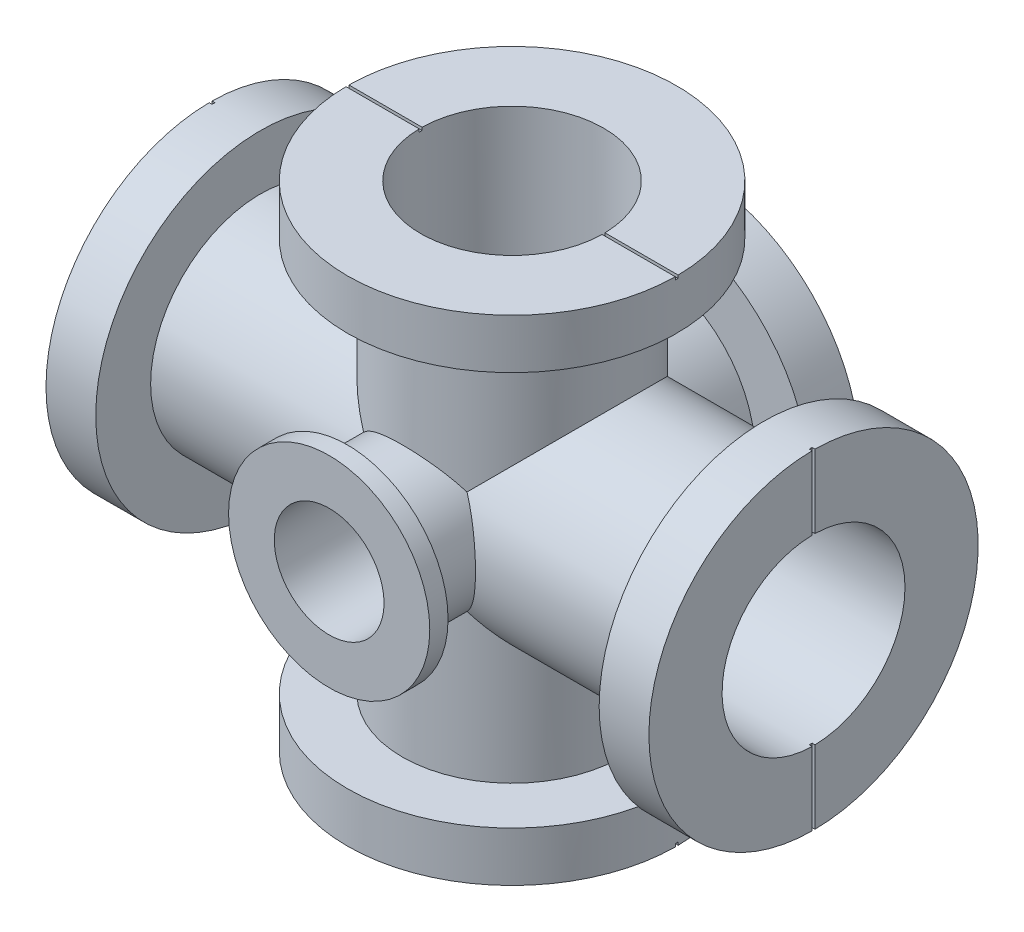
from build123d import *
from build123d.topology import SkipClean

# Parameters (mm, degrees)
SKETCH5_R          = 19.05
CUT_EXTRUDE1_DEPTH = 63.5
CUT_EXTRUDE2_START = -63.5
SKETCH6_R          = 31.75
CUT_EXTRUDE2_DEPTH = 63.5
SKETCH7_R          = 31.75
CUT_EXTRUDE3_DEPTH = 235.916668869
SKETCH8_R          = 31.75
CUT_EXTRUDE4_DEPTH = 211.662185672
SKETCH9_W          = 1
SKETCH9_H          = 1
CUT_EXTRUDE5_DEPTH = 211.662185672
SKETCH10_W         = 1
SKETCH10_H         = 1
CUT_EXTRUDE6_DEPTH = 235.916668869


with BuildPart() as part:
    # Sketch1 → Revolve2 (revolve)
    with BuildSketch(Plane(origin=(0, 0, 0), x_dir=(0, 0, -1), z_dir=(1, 0, 0))):
        Polygon((-63.5, 19.05), (-63.5, 34.925), (-57.15, 34.925), (-57.15, 25.4), (0, 25.4), (0, 19.05), align=None)
        Polygon((0, 38.1), (46.228, 38.1), (46.228, 57.15), (63.5, 57.15), (63.5, 31.75), (0, 31.75), align=None)
    revolve(axis=Axis((0, 0, 80.906165812), (0, 0, -1)))

    # Sketch2 → Revolve3 (revolve)
    with BuildSketch(Plane(origin=(0, 0, 0), x_dir=(1, 0, 0), z_dir=(0, 1, 0))):
        Polygon((-104.648, 31.75), (-104.648, 57.15), (-87.376, 57.15), (-87.376, 38.1), (87.376, 38.1), (87.376, 57.15), (104.648, 57.15), (104.648, 31.75), align=None)
    revolve(axis=Axis((-75.637974792, 0, 0), (1, 0, 0)))

    # Sketch3 → Revolve4 (revolve)
    with SkipClean():  # the faces are left unmerged after this step: merging them gives an invalid solid
        with BuildSketch(Plane.XY):
            Polygon((-38.1, -68.453), (-38.1, 68.453), (-57.15, 68.453), (-57.15, 85.725), (-31.75, 85.725), (-31.75, -85.725), (-57.15, -85.725), (-57.15, -68.453), align=None)
        revolve(axis=Axis((0, 84.837038985, 0), (0, -1, 0)))
    add(part.part.scale(1), mode=Mode.REPLACE)  # the faces are merged on a copy

    # Sketch5 → Cut-Extrude1 (cut)
    with SkipClean():  # the faces are left unmerged after this step: merging them gives an invalid solid
        with BuildSketch(Plane.XY.offset(63.5)):
            Circle(SKETCH5_R)
        extrude(amount=-CUT_EXTRUDE1_DEPTH, mode=Mode.SUBTRACT)
    add(part.part.scale(1), mode=Mode.REPLACE)  # the faces are merged on a copy

    # Sketch6 → Cut-Extrude2 (cut)
    with SkipClean():  # the faces are left unmerged after this step: merging them gives an invalid solid
        with BuildSketch(Plane(origin=(0, 0, -63.5), x_dir=(-1, 0, 0), z_dir=(0, 0, -1)).offset(CUT_EXTRUDE2_START)):
            Circle(SKETCH6_R)
        extrude(amount=CUT_EXTRUDE2_DEPTH, mode=Mode.SUBTRACT)
    add(part.part.scale(1), mode=Mode.REPLACE)  # the faces are merged on a copy

    # Sketch7 → Cut-Extrude3 (cut, through all)
    with SkipClean():  # the faces are left unmerged after this step: merging them gives an invalid solid
        with BuildSketch(Plane.ZY.offset(104.648)):
            Circle(SKETCH7_R)
        extrude(amount=-CUT_EXTRUDE3_DEPTH, mode=Mode.SUBTRACT)
    add(part.part.scale(1), mode=Mode.REPLACE)  # the faces are merged on a copy

    # Sketch8 → Cut-Extrude4 (cut, through all)
    with BuildSketch(Plane(origin=(0, 85.725, 0), x_dir=(-1, 0, 0), z_dir=(0, 1, 0))):
        Circle(SKETCH8_R)
    extrude(amount=-CUT_EXTRUDE4_DEPTH, mode=Mode.SUBTRACT)

    # Sketch9 → Cut-Extrude5 (cut, through all)
    with BuildSketch(Plane(origin=(0, 85.725, 0), x_dir=(-1, 0, 0), z_dir=(0, 1, 0))):
        with Locations((0, -63)):
            Rectangle(SKETCH9_W, SKETCH9_H)
        with Locations((104.148, 0)):
            Rectangle(SKETCH9_W, SKETCH9_H)
        with Locations((-104.148, 0)):
            Rectangle(SKETCH9_W, SKETCH9_H)
    extrude(amount=-CUT_EXTRUDE5_DEPTH, mode=Mode.SUBTRACT)

    # Sketch10 → Cut-Extrude6 (cut, through all)
    with BuildSketch(Plane.ZY.offset(104.648)):
        with Locations((0, 85.225)):
            Rectangle(SKETCH10_W, SKETCH10_H)
        with Locations((0, -85.225)):
            Rectangle(SKETCH10_W, SKETCH10_H)
    extrude(amount=-CUT_EXTRUDE6_DEPTH, mode=Mode.SUBTRACT)


solid = part.part
